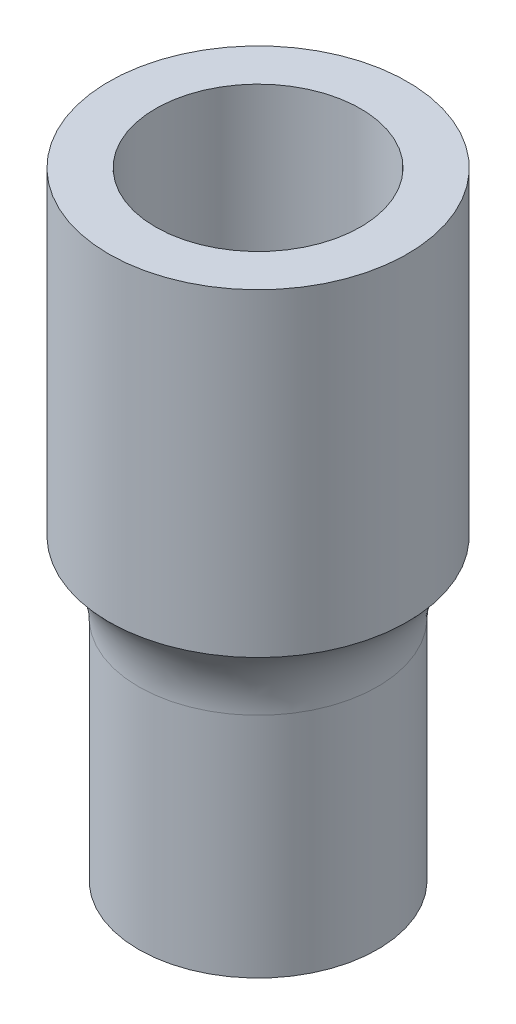
from build123d import *

# Parameters (mm, degrees)
SKETCH1_R           = 6
SKETCH1_R_2         = 4
BOSS_EXTRUDE1_DEPTH = 15
SKETCH2_R           = 7.5
BOSS_EXTRUDE2_DEPTH = 16
FILLET1_R           = 5
SKETCH3_R           = 5.15
CUT_EXTRUDE1_DEPTH  = 10


with BuildPart() as part:
    # Sketch1 → Boss-Extrude1 (new body)
    with BuildSketch(Plane(origin=(0, 0, 0), x_dir=(1, 0, 0), z_dir=(0, 1, 0))):
        with Locations(Location((0, 0, 0), (0, 0, 270))):
            Circle(SKETCH1_R)
        with Locations(Location((0, 0, 0), (0, 0, 270))):
            Circle(SKETCH1_R_2, mode=Mode.SUBTRACT)
    extrude(amount=BOSS_EXTRUDE1_DEPTH)

    # Sketch2 → Boss-Extrude2 (add)
    with BuildSketch(Plane(origin=(0, 15, 0), x_dir=(1, 0, 0), z_dir=(0, 1, 0))):
        with Locations(Location((0, 0, 0), (0, 0, 270))):
            Circle(SKETCH2_R)
    extrude(amount=BOSS_EXTRUDE2_DEPTH)

    # Fillet1
    # the kernel refuses this fillet: 5 mm, written as the material it adds along each edge
    with BuildSketch(Plane(origin=(0, 15, 0), x_dir=(0, 0, 1), z_dir=(-1, 0, 0))) as fillet1_piece_1:
        with BuildLine():
            CenterArc((11, -3.570714214), FILLET1_R, 134.427004001, 45.572995999)
            Line((6, -3.570714214), (5.9, -3.570714214))
            Line((5.9, -3.570714214), (5.9, 0))
            Line((5.9, 0), (6, 0.1))
            ThreePointArc((6, 0.1), (6.75, 0.1), (7.43, 0.071414284))
            Line((7.43, 0.071414284), (7.5, 0))
        make_face()
    revolve(axis=Axis((0, 15, 0), (0, 1, 0)))

    # Sketch3 → Cut-Extrude1 (cut)
    with BuildSketch(Plane(origin=(0, 31, 0), x_dir=(1, 0, 0), z_dir=(0, 1, 0))):
        with Locations(Location((0, 0, 0), (0, 0, 270))):
            Circle(SKETCH3_R)
    extrude(amount=-CUT_EXTRUDE1_DEPTH, mode=Mode.SUBTRACT)


solid = part.part
